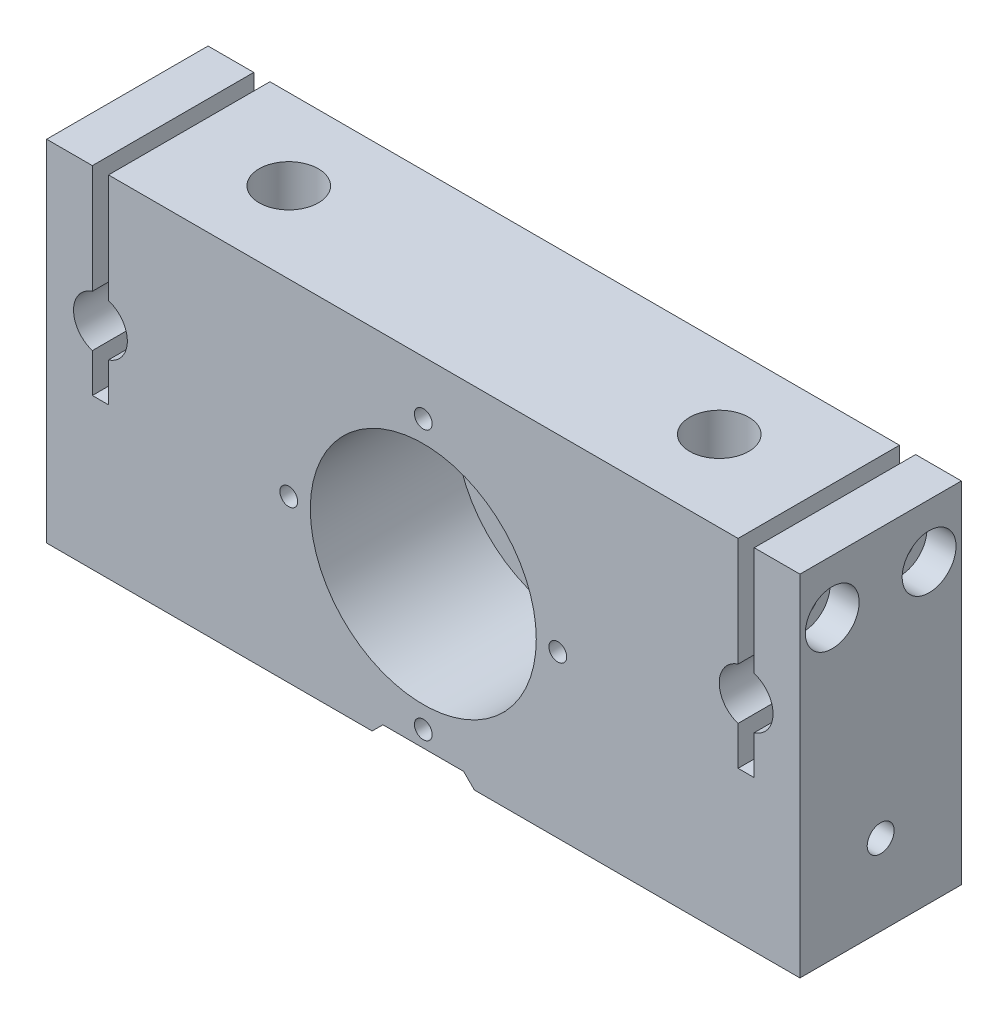
from build123d import *

# Parameters (mm, degrees)
SKETCH1_W                                           = 140
SKETCH1_H                                           = 65
BOSS_EXTRUDE1_DEPTH                                 = 30
SKETCH2_R                                           = 21
CUT_EXTRUDE2_DEPTH                                  = 27
SKETCH4_R                                           = 16.75
CUT_EXTRUDE3_DEPTH                                  = 82.76337811
SKETCH5_R                                           = 5
CUT_EXTRUDE4_DEPTH                                  = 83.802475808
SKETCH6_W                                           = 3
SKETCH6_H                                           = 37
CUT_EXTRUDE5_DEPTH                                  = 83.802475808
CBORE_FOR_M5_HEX_SOCKET_HEAD_CAP_SCREW1_D           = 5.5
CBORE_FOR_M5_HEX_SOCKET_HEAD_CAP_SCREW1_DEPTH       = 8.5
CBORE_FOR_M5_HEX_SOCKET_HEAD_CAP_SCREW1_CBORE_D     = 10
CBORE_FOR_M5_HEX_SOCKET_HEAD_CAP_SCREW1_CBORE_DEPTH = 5.4
TAP_DRILL_FOR_M5_TAP1_AT_2_COUNT                    = 2
TAP_DRILL_FOR_M5_TAP1_AT_2_PITCH                    = 18
CBORE_FOR_M6_HEX_SOCKET_HEAD_CAP_SCREW3_D           = 6.6
CBORE_FOR_M6_HEX_SOCKET_HEAD_CAP_SCREW3_CBORE_D     = 11
CBORE_FOR_M6_HEX_SOCKET_HEAD_CAP_SCREW3_CBORE_DEPTH = 61.4
CIRPATTERN1_COUNT                                   = 4
SKETCH29_W                                          = 35
SKETCH29_H                                          = 2
CUT_EXTRUDE6_DEPTH                                  = 83.802475808
CHAMFER2_SIZE                                       = 10


with BuildPart() as part:
    # Sketch1 → Boss-Extrude1 (new body)
    with BuildSketch(Plane.XY):
        Rectangle(SKETCH1_W, SKETCH1_H)
    extrude(amount=BOSS_EXTRUDE1_DEPTH)

    # Sketch2 → Cut-Extrude2 (cut)
    with BuildSketch(Plane(origin=(0, 0, 30), x_dir=(-1, 0, 0), z_dir=(0, 0, -1))):
        with Locations((0, -2.5)):
            Circle(SKETCH2_R)
    extrude(amount=CUT_EXTRUDE2_DEPTH, mode=Mode.SUBTRACT)

    # Sketch4 → Cut-Extrude3 (cut, through all)
    with BuildSketch(Plane.XY.offset(3)):
        with Locations((0, -2.5)):
            Circle(SKETCH4_R)
    extrude(amount=-CUT_EXTRUDE3_DEPTH, mode=Mode.SUBTRACT)

    # Sketch5 → Cut-Extrude4 (cut, through all)
    with BuildSketch(Plane(origin=(0, 0, 0), x_dir=(-1, 0, 0), z_dir=(0, 0, -1))):
        with Locations((-60, 7.5)):
            Circle(SKETCH5_R)
        with Locations((60, 7.5)):
            Circle(SKETCH5_R)
    extrude(amount=-CUT_EXTRUDE4_DEPTH, mode=Mode.SUBTRACT)

    # Sketch6 → Cut-Extrude5 (cut, through all)
    with BuildSketch(Plane(origin=(0, 0, 0), x_dir=(-1, 0, 0), z_dir=(0, 0, -1))):
        with Locations((-60, 14)):
            Rectangle(SKETCH6_W, SKETCH6_H)
        with Locations((60, 14)):
            Rectangle(SKETCH6_W, SKETCH6_H)
    extrude(amount=-CUT_EXTRUDE5_DEPTH, mode=Mode.SUBTRACT)

    # CBORE for M5 Hex Socket Head Cap Screw1
    with Locations(Plane(origin=(70, 0, 0), x_dir=(0, 0, -1), z_dir=(1, 0, 0))):
        with Locations((-6, 22.5), (-24, 22.5)):
            cbore_for_m5_hex_socket_head_cap_screw1 = CounterBoreHole(CBORE_FOR_M5_HEX_SOCKET_HEAD_CAP_SCREW1_D / 2, CBORE_FOR_M5_HEX_SOCKET_HEAD_CAP_SCREW1_CBORE_D / 2, CBORE_FOR_M5_HEX_SOCKET_HEAD_CAP_SCREW1_CBORE_DEPTH, depth=CBORE_FOR_M5_HEX_SOCKET_HEAD_CAP_SCREW1_DEPTH)

    # Sketch12 → Tap Drill for M5 Tap1 (revolve, cut)
    with BuildSketch(Plane(origin=(58.5, 22.5, 6), x_dir=(0, 0, -1), z_dir=(0, 1, 0))):
        Polygon((0, 0), (0, 13.2618073), (2.1, 12), (2.1, 0), align=None)
    tap_drill_for_m5_tap1 = revolve(axis=Axis((64.85, 22.5, 6), (-1, 0, 0)), mode=Mode.SUBTRACT)

    # Tap Drill for M5 Tap1 at 2: Tap Drill for M5 Tap1 ×2
    with Locations(*[(0, 0, i * TAP_DRILL_FOR_M5_TAP1_AT_2_PITCH) for i in range(1, TAP_DRILL_FOR_M5_TAP1_AT_2_COUNT)]):
        add(tap_drill_for_m5_tap1, mode=Mode.SUBTRACT)

    # Sketch15 → Tap Drill for M6 Tap1 (revolve, cut)
    with BuildSketch(Plane(origin=(70, -17.5, 15), x_dir=(0, 0, -1), z_dir=(0, 1, 0))):
        Polygon((0, 0), (0, 16.502151548), (2.5, 15), (2.5, 0), align=None)
    tap_drill_for_m6_tap1 = revolve(axis=Axis((76.35, -17.5, 15), (-1, 0, 0)), mode=Mode.SUBTRACT)

    # Mirror1: CBORE for M5 Hex Socket Head Cap Screw1, Tap Drill for M5 Tap1, Tap Drill for M6 Tap1 across plane
    add(cbore_for_m5_hex_socket_head_cap_screw1.mirror(Plane(origin=(0, 0, 0), x_dir=(0, 0, 1), z_dir=(1, 0, 0))), mode=Mode.SUBTRACT)
    add(tap_drill_for_m5_tap1.mirror(Plane(origin=(0, 0, 0), x_dir=(0, 0, 1), z_dir=(1, 0, 0))), mode=Mode.SUBTRACT)
    add(tap_drill_for_m6_tap1.mirror(Plane(origin=(0, 0, 0), x_dir=(0, 0, 1), z_dir=(1, 0, 0))), mode=Mode.SUBTRACT)

    # Mirror1 copy 1 sketch → Mirror1 copy 1 (revolve, cut)
    with BuildSketch(Plane(origin=(-58.5, 22.5, 24), x_dir=(0, 0, -1), z_dir=(0, 1, 0))):
        Polygon((0, 0), (0, -13.2618073), (2.1, -12), (2.1, 0), align=None)
    revolve(axis=Axis((-64.85, 22.5, 24), (-1, 0, 0)), mode=Mode.SUBTRACT)

    # CBORE for M6 Hex Socket Head Cap Screw3 (through all)
    with Locations(Plane(origin=(0, 32.5, 0), x_dir=(1, 0, 0), z_dir=(0, 1, 0))):
        with Locations((40, -15), (-40, -15)):
            CounterBoreHole(CBORE_FOR_M6_HEX_SOCKET_HEAD_CAP_SCREW3_D / 2, CBORE_FOR_M6_HEX_SOCKET_HEAD_CAP_SCREW3_CBORE_D / 2, CBORE_FOR_M6_HEX_SOCKET_HEAD_CAP_SCREW3_CBORE_DEPTH)

    # Sketch28 → Tap Drill for M4 Tap1 (revolve, cut)
    with BuildSketch(Plane(origin=(0, 22.5, 30), x_dir=(0, -1, 0), z_dir=(1, 0, 0))):
        Polygon((0, 0), (0, 8.991420021), (1.65, 8), (1.65, 0), align=None)
    tap_drill_for_m4_tap1 = revolve(axis=Axis((0, 22.5, 36.35), (0, 0, -1)), mode=Mode.SUBTRACT)

    # CirPattern1: Tap Drill for M4 Tap1 ×4 about axis
    cirpattern1_axis = Axis((0, -2.5, 0), (0, 0, 1))
    for i in range(1, CIRPATTERN1_COUNT):
        add(tap_drill_for_m4_tap1.rotate(cirpattern1_axis, i * 360 / CIRPATTERN1_COUNT), mode=Mode.SUBTRACT)

    # Sketch29 → Cut-Extrude6 (cut, through all)
    with BuildSketch(Plane.XY.offset(30)):
        with Locations((0, -31.5)):
            Rectangle(SKETCH29_W, SKETCH29_H)
    extrude(amount=-CUT_EXTRUDE6_DEPTH, mode=Mode.SUBTRACT)

    # Chamfer2
    # the kernel refuses this chamfer: 10 mm, written as the material it adds along each edge
    with BuildSketch(Plane(origin=(-17.5, -30.5, 30), x_dir=(-0.02749587661058977, -0.9996219169112965, 0), z_dir=(0, 0, -1))) as chamfer2_piece_1_section:
        Polygon((CHAMFER2_SIZE * 0.999621916911, -CHAMFER2_SIZE * 0.0274958766106), (-CHAMFER2_SIZE * 0.0274958766106, -CHAMFER2_SIZE * 0.999621916911), (0, 0), align=None)
    chamfer2_piece_1 = extrude(amount=30, mode=Mode.PRIVATE)
    chamfer2_piece_1 = split(chamfer2_piece_1, bisect_by=Plane(origin=(-12.880949734, -32.5, 15), z_dir=(0, 1, 0)), keep=Keep.TOP, mode=Mode.PRIVATE)
    add(chamfer2_piece_1)
    with BuildSketch(Plane(origin=(17.5, -30.5, 30), x_dir=(-0.9996219169112968, 0.027495876610586317, 0), z_dir=(0, 0, -1))) as chamfer2_piece_2_section:
        Polygon((CHAMFER2_SIZE * 0.999621916911, -CHAMFER2_SIZE * 0.0274958766106), (-CHAMFER2_SIZE * 0.0274958766106, -CHAMFER2_SIZE * 0.999621916911), (0, 0), align=None)
    chamfer2_piece_2 = extrude(amount=30, mode=Mode.PRIVATE)
    chamfer2_piece_2 = split(chamfer2_piece_2, bisect_by=Plane(origin=(12.880949734, -32.5, 15), z_dir=(0, 1, 0)), keep=Keep.TOP, mode=Mode.PRIVATE)
    add(chamfer2_piece_2)


solid = part.part
